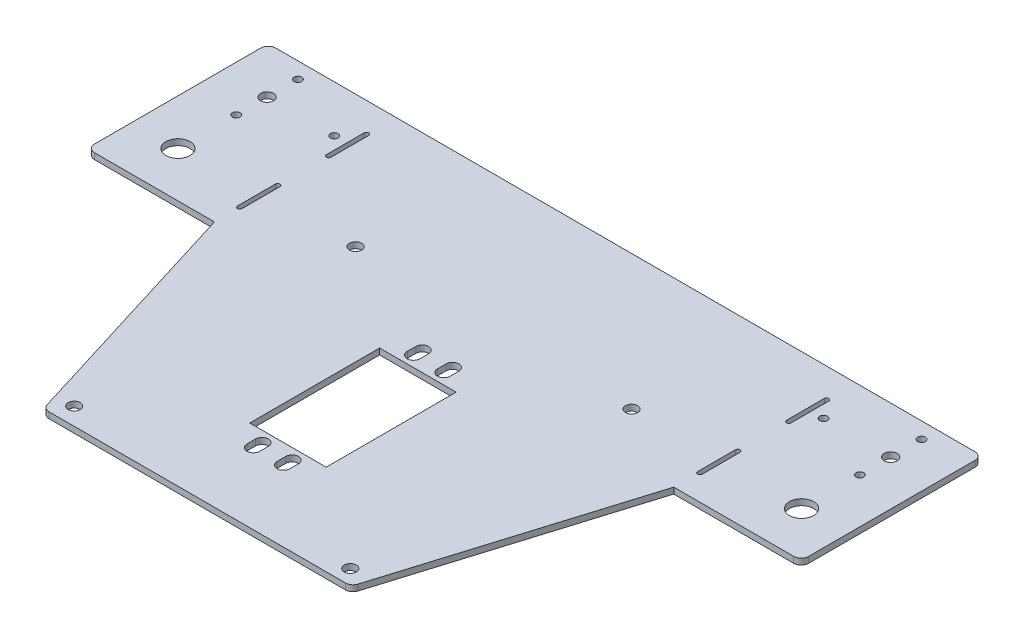
from build123d import *

# Parameters (mm, degrees)
SKETCH26_R          = 2
SKETCH26_W          = 25.31
SKETCH26_H          = 43
SKETCH26_R_2        = 4
SKETCH26_R_3        = 1.27
SKETCH26_R_4        = 2.141312715
BOSS_EXTRUDE4_DEPTH = 2


with BuildPart() as part:
    # Sketch26 → Boss-Extrude4 (new body)
    with BuildSketch(Plane(origin=(0, 0, 0), x_dir=(1, 0, 0), z_dir=(0, 1, 0))):
        with BuildLine():
            Line((75.767236042, 90.766820858), (50.767236042, 90.766820858))
            Line((50.767236042, 90.766820858), (-51.032763958, 90.766820858))
            Line((-51.032763958, 90.766820858), (-76.278800323, 90.766820858))
            Line((-76.278800323, 90.766820858), (-115.954777141, 90.766820858))
            ThreePointArc((-115.954777141, 90.766820858), (-117.722544094, 90.034587811), (-118.454777141, 88.266820858))
            Line((-118.454777141, 88.266820858), (-118.454777141, 33.266820858))
            ThreePointArc((-118.454777141, 33.266820858), (-117.722544094, 31.499053905), (-115.954777141, 30.766820858))
            Line((-115.954777141, 30.766820858), (-76.278800323, 30.766820858))
            Line((-76.278800323, 30.766820858), (-51.571443107, -49.270587217))
            ThreePointArc((-51.571443107, -49.270587217), (-50.667003064, -50.544835199), (-49.182671596, -51.033179142))
            Line((-49.182671596, -51.033179142), (48.917143681, -51.033179142))
            ThreePointArc((48.917143681, -51.033179142), (50.404299167, -50.542748389), (51.307977226, -49.26387399))
            Line((51.307977226, -49.26387399), (75.767236042, 30.766820858))
            Line((75.767236042, 30.766820858), (115.443212861, 30.766820858))
            ThreePointArc((115.443212861, 30.766820858), (117.210979814, 31.499053905), (117.943212861, 33.266820858))
            Line((117.943212861, 33.266820858), (117.943212861, 88.266820858))
            ThreePointArc((117.943212861, 88.266820858), (117.210979814, 90.034587811), (115.443212861, 90.766820858))
            Line((115.443212861, 90.766820858), (75.767236042, 90.766820858))
        make_face()
        with Locations((-46.69611172, -45.222783471)):
            Circle(SKETCH26_R, mode=Mode.SUBTRACT)
        with BuildLine():
            ThreePointArc((-7.243301994, -24.633179142), (-5.132763958, -22.522641105), (-3.022225921, -24.633179142))
            Line((-3.022225921, -24.633179142), (-3.022225921, -27.479842865))
            ThreePointArc((-3.022225921, -27.479842865), (-5.132763958, -29.590380902), (-7.243301994, -27.479842865))
            Line((-7.243301994, -27.479842865), (-7.243301994, -24.633179142))
        make_face(mode=Mode.SUBTRACT)
        with Locations((45.556840372, -46.096526904)):
            Circle(SKETCH26_R, mode=Mode.SUBTRACT)
        with BuildLine():
            Line((2.756698006, -27.479842865), (2.756698006, -24.633179142))
            ThreePointArc((2.756698006, -24.633179142), (4.867236042, -22.522641105), (6.977774079, -24.633179142))
            Line((6.977774079, -24.633179142), (6.977774079, -27.479842865))
            ThreePointArc((6.977774079, -27.479842865), (4.867236042, -29.590380902), (2.756698006, -27.479842865))
        make_face(mode=Mode.SUBTRACT)
        with Locations((-0.132763958, 0.466820858)):
            Rectangle(SKETCH26_W, SKETCH26_H, mode=Mode.SUBTRACT)
        with Locations((-103.332763958, 45.766820858)):
            Circle(SKETCH26_R_2, mode=Mode.SUBTRACT)
        with BuildLine():
            ThreePointArc((-75.528800323, 39.191107079), (-76.278800323, 38.441107079), (-77.028800323, 39.191107079))
            Line((-77.028800323, 39.191107079), (-77.028800323, 51.691107079))
            ThreePointArc((-77.028800323, 51.691107079), (-76.278800323, 52.441107079), (-75.528800323, 51.691107079))
            Line((-75.528800323, 51.691107079), (-75.528800323, 39.191107079))
        make_face(mode=Mode.SUBTRACT)
        with BuildLine():
            Line((-3.022225921, 28.413484582), (-3.022225921, 25.566820858))
            ThreePointArc((-3.022225921, 25.566820858), (-5.132763958, 23.456282821), (-7.243301994, 25.566820858))
            Line((-7.243301994, 25.566820858), (-7.243301994, 28.413484582))
            ThreePointArc((-7.243301994, 28.413484582), (-5.132763958, 30.524022619), (-3.022225921, 28.413484582))
        make_face(mode=Mode.SUBTRACT)
        with Locations((-45.822368287, 47.030168621)):
            Circle(SKETCH26_R, mode=Mode.SUBTRACT)
        with Locations((-103.332763958, 65.066820858)):
            Circle(SKETCH26_R_3, mode=Mode.SUBTRACT)
        with Locations((-103.332763958, 75.266820858)):
            Circle(SKETCH26_R_4, mode=Mode.SUBTRACT)
        with Locations((-103.332763958, 85.466820858)):
            Circle(SKETCH26_R_3, mode=Mode.SUBTRACT)
        with BuildLine():
            ThreePointArc((-77.028800323, 81.095149015), (-76.278800323, 81.845149015), (-75.528800323, 81.095149015))
            Line((-75.528800323, 81.095149015), (-75.528800323, 68.595149015))
            ThreePointArc((-75.528800323, 68.595149015), (-76.278800323, 67.845149015), (-77.028800323, 68.595149015))
            Line((-77.028800323, 68.595149015), (-77.028800323, 81.095149015))
        make_face(mode=Mode.SUBTRACT)
        with Locations((-81.132763958, 75.266820858)):
            Circle(SKETCH26_R_3, mode=Mode.SUBTRACT)
        with BuildLine():
            ThreePointArc((6.977774079, 25.566820858), (4.867236042, 23.456282821), (2.756698006, 25.566820858))
            Line((2.756698006, 25.566820858), (2.756698006, 28.413484582))
            ThreePointArc((2.756698006, 28.413484582), (4.867236042, 30.524022619), (6.977774079, 28.413484582))
            Line((6.977774079, 28.413484582), (6.977774079, 25.566820858))
        make_face(mode=Mode.SUBTRACT)
        with Locations((46.430583805, 46.156425188)):
            Circle(SKETCH26_R, mode=Mode.SUBTRACT)
        with BuildLine():
            Line((76.763272408, 51.691107079), (76.763272408, 39.191107079))
            ThreePointArc((76.763272408, 39.191107079), (76.013272408, 38.441107079), (75.263272408, 39.191107079))
            Line((75.263272408, 39.191107079), (75.263272408, 51.691107079))
            ThreePointArc((75.263272408, 51.691107079), (76.013272408, 52.441107079), (76.763272408, 51.691107079))
        make_face(mode=Mode.SUBTRACT)
        with Locations((103.067236042, 45.766820858)):
            Circle(SKETCH26_R_2, mode=Mode.SUBTRACT)
        with Locations((103.067236042, 65.066820858)):
            Circle(SKETCH26_R_3, mode=Mode.SUBTRACT)
        with BuildLine():
            Line((75.263272408, 68.595149015), (75.263272408, 81.095149015))
            ThreePointArc((75.263272408, 81.095149015), (76.013272408, 81.845149015), (76.763272408, 81.095149015))
            Line((76.763272408, 81.095149015), (76.763272408, 68.595149015))
            ThreePointArc((76.763272408, 68.595149015), (76.013272408, 67.845149015), (75.263272408, 68.595149015))
        make_face(mode=Mode.SUBTRACT)
        with Locations((80.867236042, 75.266820858)):
            Circle(SKETCH26_R_3, mode=Mode.SUBTRACT)
        with Locations((103.067236042, 75.266820858)):
            Circle(SKETCH26_R_4, mode=Mode.SUBTRACT)
        with Locations((103.067236042, 85.466820858)):
            Circle(SKETCH26_R_3, mode=Mode.SUBTRACT)
    extrude(amount=BOSS_EXTRUDE4_DEPTH)


solid = part.part
